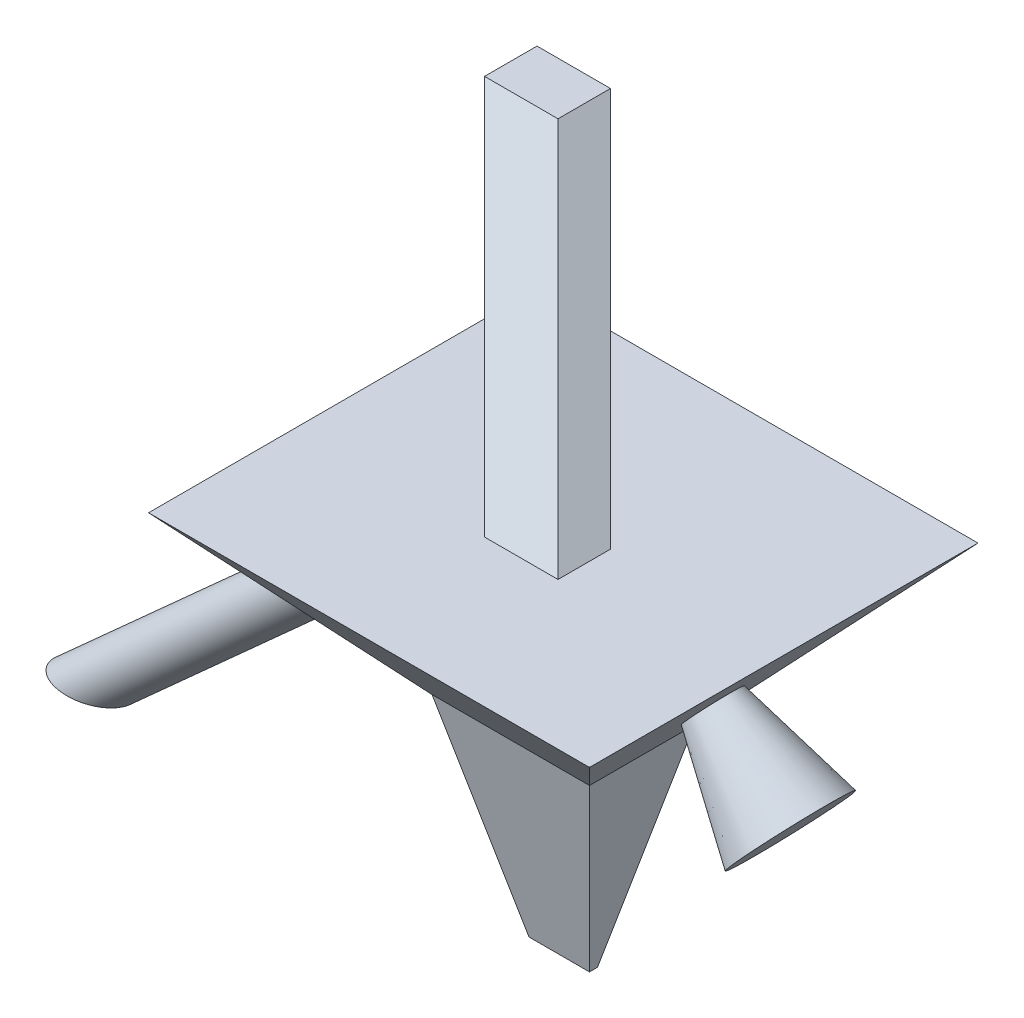
from build123d import *

# Parameters (mm, degrees)
SKETCH1_W           = 750
SKETCH1_H           = 500
BOSS_EXTRUDE1_DEPTH = 1000
BOSS_EXTRUDE1_DRAFT = -13
SKETCH1_2_W         = 750
SKETCH1_2_H         = 500
BOSS_EXTRUDE2_DEPTH = 750
BOSS_EXTRUDE2_TAPER = -42
SKETCH2_R           = 125
BOSS_EXTRUDE3_DEPTH = 497.562106
BOSS_EXTRUDE3_DRAFT = -15
BOSS_EXTRUDE4_REACH = 2194.301
SKETCH4_R           = 125


with BuildPart() as part:
    # Sketch1 → Boss-Extrude1 (with draft: the straight prism first)
    with BuildSketch(Plane(origin=(0, 0, 0), x_dir=(1, 0, 0), z_dir=(0, 1, 0))):
        Rectangle(SKETCH1_W, SKETCH1_H)
    extrude(amount=-BOSS_EXTRUDE1_DEPTH)
    # Boss-Extrude1: the draft: its side faces are tilted about the plane it starts from
    boss_extrude1_sides = [part.faces().sort_by_distance(p)[0] for p in [
        (0, -500, 250),
        (375, -500, 0),
        (0, -500, -250),
        (-375, -500, 0),
    ]]
    draft(boss_extrude1_sides, Plane(origin=(0, 0, 0), x_dir=(1, 0, 0), z_dir=(0, 1, 0)), BOSS_EXTRUDE1_DRAFT)

    # Sketch1<2> → Boss-Extrude2 (add)
    with BuildSketch(Plane(origin=(0, 0, 0), x_dir=(1, 0, 0), z_dir=(0, 1, 0))):
        Rectangle(SKETCH1_2_W, SKETCH1_2_H)
    extrude(amount=BOSS_EXTRUDE2_DEPTH, taper=BOSS_EXTRUDE2_TAPER)


with BuildPart() as boss_extrude3_tool:
    # Sketch2 → Boss-Extrude3 (with draft: the straight prism first)
    with BuildSketch(Plane(origin=(207.099086863, -186.472855382, 0), x_dir=(0, 0, -1), z_dir=(0.7431448254773932, -0.6691306063588595, 0))):
        with Locations((0, 755.148524589)):
            Circle(SKETCH2_R)
    extrude(amount=BOSS_EXTRUDE3_DEPTH)
    # Boss-Extrude3: the draft: its side faces are tilted about the plane it starts from
    boss_extrude3_sides = [boss_extrude3_tool.faces().sort_by_distance(p)[0] for p in [
        (897.272429226, 208.244846289, 125),
    ]]
    draft(boss_extrude3_sides, Plane(origin=(207.099086863, -186.472855382, 0), x_dir=(0, 0, -1), z_dir=(0.7431448254773932, -0.6691306063588595, 0)), BOSS_EXTRUDE3_DRAFT)


with BuildPart() as part_1:
    add(part.part)

    # Boss-Extrude3: add boss_extrude3_tool
    add(boss_extrude3_tool.part)

    # Boss-Extrude4: up to this plane
    boss_extrude4_end = Plane(origin=(0, -1000, 0), z_dir=(0, -1, 0))
    # Sketch4 → Boss-Extrude4 (add, up to the surface)
    with BuildSketch(Plane(origin=(-207.099086863, -186.472855382, 0), x_dir=(0, 0, 1), z_dir=(-0.7431448254773932, -0.6691306063588595, 0)), mode=Mode.PRIVATE) as boss_extrude4_sk1:
        with Locations(Location((0, 755.148524589, 0), (0, 0, 270))):
            Circle(SKETCH4_R)
    boss_extrude4_tool1 = split(extrude(boss_extrude4_sk1.sketch, amount=BOSS_EXTRUDE4_REACH, mode=Mode.PRIVATE), bisect_by=boss_extrude4_end, keep=Keep.BOTH, mode=Mode.PRIVATE)
    add(boss_extrude4_tool1.solids().sort_by_distance((-712.392077, 374.711863, 0))[0])

    # Boss-Extrude5: read off the stored shape, not the designer's step
    # Boss-Extrude5: loft between two sections, ruled curve by curve
    boss_extrude5_from = [
        Edge.make_line((-1050.303033223, 1750, -675.303033223), (-700.303033223, 1750, -675.303033223)),
        Edge.make_line((-700.303033223, 1750, -675.303033223), (-700.303033223, 1750, -925.303033223)),
        Edge.make_line((-700.303033223, 1750, -925.303033223), (-1050.303033223, 1750, -925.303033223)),
        Edge.make_line((-1050.303033223, 1750, -925.303033223), (-1050.303033223, 1750, -675.303033223)),
    ]
    boss_extrude5_to = [
        Edge.make_line((-149.898988926, 750, 225.101011074), (200.101011074, 750, 225.101011074)),
        Edge.make_line((200.101011074, 750, 225.101011074), (200.101011074, 750, -24.898988926)),
        Edge.make_line((200.101011074, 750, -24.898988926), (-149.898988926, 750, -24.898988926)),
        Edge.make_line((-149.898988926, 750, -24.898988926), (-149.898988926, 750, 225.101011074)),
    ]
    boss_extrude5 = Solid(Shell([*[Face.make_surface_from_curves(boss_extrude5_from[k], boss_extrude5_to[k]) for k in range(4)], Face(Wire(boss_extrude5_from)), Face(Wire(boss_extrude5_to))]))
    add(boss_extrude5)


solid = part_1.part
